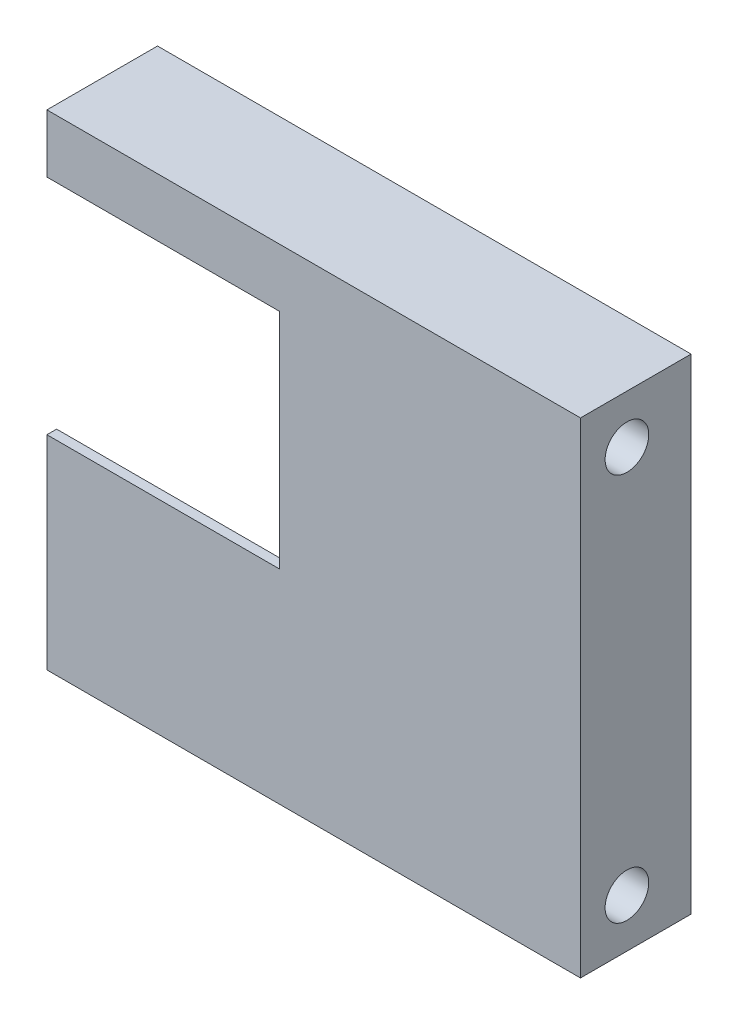
from build123d import *

# Parameters (mm, degrees)
BOSS_EXTRUDE1_DEPTH = 1
SKETCH2_W           = 50
SKETCH2_H           = 11.4
BOSS_EXTRUDE2_DEPTH = 4.4
SKETCH3_R           = 2.25
CUT_EXTRUDE1_DEPTH  = 4.4
SKETCH4_W           = 50.6
SKETCH4_H           = 5.5
BOSS_EXTRUDE3_DEPTH = 6.4
SKETCH5_W           = 50.6
SKETCH5_H           = 4.5
BOSS_EXTRUDE4_DEPTH = 2
SKETCH6_W           = 50.6
SKETCH6_H           = 5.5
BOSS_EXTRUDE5_DEPTH = 2


with BuildPart() as part:
    # Sketch1 → Boss-Extrude1 (new body)
    with BuildSketch(Plane(origin=(0, 0, 0), x_dir=(0, 1, 0), z_dir=(0, 0, 1))):
        Polygon((-4, 25.3), (-4, 1.3), (19, 1.3), (19, 25.3), (25, 25.3), (25, -25.3), (-25, -25.3), (-25, 25.3), align=None)
    extrude(amount=BOSS_EXTRUDE1_DEPTH)

    # Sketch2 → Boss-Extrude2 (add)
    with BuildSketch(Plane.YZ.offset(25.3)):
        with Locations((0, -4.7)):
            Rectangle(SKETCH2_W, SKETCH2_H)
    extrude(amount=BOSS_EXTRUDE2_DEPTH)

    # Sketch3 → Cut-Extrude1 (cut)
    with BuildSketch(Plane.YZ.offset(29.7)):
        with Locations((-20, -3.787139035)):
            Circle(SKETCH3_R)
        with Locations((20, -3.787139035)):
            Circle(SKETCH3_R)
    extrude(amount=-CUT_EXTRUDE1_DEPTH, mode=Mode.SUBTRACT)

    # Sketch4 → Boss-Extrude3 (add)
    with BuildSketch(Plane(origin=(0, 0, 0), x_dir=(1, 0, 0), z_dir=(0, 0, -1))):
        with Locations((0, -22.25)):
            Rectangle(SKETCH4_W, SKETCH4_H)
        with Locations((0, 22.25)):
            Rectangle(SKETCH4_W, SKETCH4_H)
    extrude(amount=BOSS_EXTRUDE3_DEPTH)

    # Sketch5 → Boss-Extrude4 (add)
    with BuildSketch(Plane(origin=(0, 0, -6.4), x_dir=(1, 0, 0), z_dir=(0, 0, -1))):
        with Locations((0, 22.75)):
            Rectangle(SKETCH5_W, SKETCH5_H)
        with Locations((0, -22.75)):
            Rectangle(SKETCH5_W, SKETCH5_H)
    extrude(amount=BOSS_EXTRUDE4_DEPTH)

    # Sketch6 → Boss-Extrude5 (add)
    with BuildSketch(Plane(origin=(0, 0, -8.4), x_dir=(1, 0, 0), z_dir=(0, 0, -1))):
        with Locations((0, -22.25)):
            Rectangle(SKETCH6_W, SKETCH6_H)
        with Locations((0, 22.25)):
            Rectangle(SKETCH6_W, SKETCH6_H)
    extrude(amount=BOSS_EXTRUDE5_DEPTH)


solid = part.part
